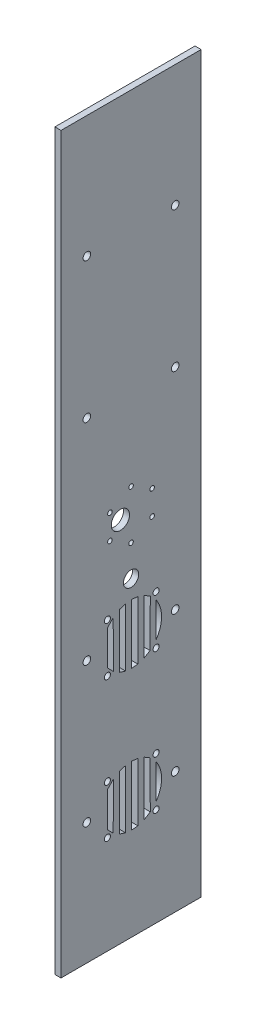
from build123d import *

# Parameters (mm, degrees)
CROQUIS3_W              = 92
CROQUIS3_H              = 482
CROQUIS3_R              = 2.5
CROQUIS3_R_2            = 2
CROQUIS3_R_3            = 5
CROQUIS3_R_4            = 1.5
CROQUIS3_R_5            = 6
SALIENTE_EXTRUIR1_DEPTH = 4
CORTAR_EXTRUIR1_DEPTH   = 10


with BuildPart() as part:
    # Croquis3 → Saliente-Extruir1 (new body)
    with BuildSketch(Plane.ZY.offset(90.501614904)):
        with Locations((-42, 944.628389678)):
            Rectangle(CROQUIS3_W, CROQUIS3_H)
        with Locations((-71.000454801, 783.628389678)):
            Circle(CROQUIS3_R, mode=Mode.SUBTRACT)
        with Locations((-58.458881304, 768.118311041)):
            Circle(CROQUIS3_R_2, mode=Mode.SUBTRACT)
        with Locations((-58.458881304, 800.118311041)):
            Circle(CROQUIS3_R_2, mode=Mode.SUBTRACT)
        with Locations((-26.458881304, 800.118311041)):
            Circle(CROQUIS3_R_2, mode=Mode.SUBTRACT)
        with Locations((-26.458881304, 768.118311041)):
            Circle(CROQUIS3_R_2, mode=Mode.SUBTRACT)
        with Locations((-13.000454801, 783.628389678)):
            Circle(CROQUIS3_R, mode=Mode.SUBTRACT)
        with Locations((-58.458881304, 860.118311041)):
            Circle(CROQUIS3_R_2, mode=Mode.SUBTRACT)
        with Locations((-58.458881304, 892.118311041)):
            Circle(CROQUIS3_R_2, mode=Mode.SUBTRACT)
        with Locations((-26.458881304, 892.118311041)):
            Circle(CROQUIS3_R_2, mode=Mode.SUBTRACT)
        with Locations((-26.458881304, 860.118311041)):
            Circle(CROQUIS3_R_2, mode=Mode.SUBTRACT)
        with Locations((-13.000454801, 875.628389678)):
            Circle(CROQUIS3_R, mode=Mode.SUBTRACT)
        with Locations((-42.000454801, 907.728389678)):
            Circle(CROQUIS3_R_3, mode=Mode.SUBTRACT)
        with Locations((-42.000454801, 928.11276849)):
            Circle(CROQUIS3_R_4, mode=Mode.SUBTRACT)
        with Locations((-35.000454801, 944.628389678)):
            Circle(CROQUIS3_R_5, mode=Mode.SUBTRACT)
        with Locations((-28.137284168, 936.116673787)):
            Circle(CROQUIS3_R_4, mode=Mode.SUBTRACT)
        with Locations((-28.137284168, 952.124484381)):
            Circle(CROQUIS3_R_4, mode=Mode.SUBTRACT)
        with Locations((-42.000454801, 960.128389678)):
            Circle(CROQUIS3_R_4, mode=Mode.SUBTRACT)
        with Locations((-55.863625434, 952.124484381)):
            Circle(CROQUIS3_R_4, mode=Mode.SUBTRACT)
        with Locations((-55.863625434, 936.116673787)):
            Circle(CROQUIS3_R_4, mode=Mode.SUBTRACT)
        with Locations((-71.000454801, 1013.628389678)):
            Circle(CROQUIS3_R, mode=Mode.SUBTRACT)
        with Locations((-13.000454801, 1013.628389678)):
            Circle(CROQUIS3_R, mode=Mode.SUBTRACT)
        with Locations((-13.000454801, 1105.628389678)):
            Circle(CROQUIS3_R, mode=Mode.SUBTRACT)
        with Locations((-71.000454801, 1105.628389678)):
            Circle(CROQUIS3_R, mode=Mode.SUBTRACT)
        with Locations((-71.000454801, 875.628389678)):
            Circle(CROQUIS3_R, mode=Mode.SUBTRACT)
        with BuildLine():
            Line((-58.458881304, 795.421766265), (-58.458881304, 772.814855817))
            ThreePointArc((-58.458881304, 772.814855817), (-62.048881304, 784.118311041), (-58.458881304, 795.421766265))
        make_face(mode=Mode.SUBTRACT)
        Polygon((-50.458881304, 802.000371885), (-50.458881304, 766.236250198), (-54.642369893, 768.777818683), (-54.458881304, 799.602758077), align=None, mode=Mode.SUBTRACT)
        Polygon((-46.458881304, 803.29559187), (-46.458881304, 764.941030212), (-42.458881304, 764.528311041), (-42.458881304, 803.708311041), align=None, mode=Mode.SUBTRACT)
        Polygon((-38.458881304, 803.29559187), (-38.458881304, 764.941030212), (-34.458881304, 766.236250198), (-34.458881304, 802.000371885), align=None, mode=Mode.SUBTRACT)
        Polygon((-30.458881304, 799.602758077), (-30.275392715, 768.777818683), (-26.458881304, 772.814855817), (-26.458881304, 795.421766265), align=None, mode=Mode.SUBTRACT)
        Polygon((-26.458881304, 887.421766265), (-30.275392715, 891.4588034), (-30.458881304, 860.633864006), (-26.458881304, 864.814855817), align=None, mode=Mode.SUBTRACT)
        Polygon((-34.458881304, 894.000371885), (-38.458881304, 895.29559187), (-38.458881304, 856.941030212), (-34.458881304, 858.236250198), align=None, mode=Mode.SUBTRACT)
        Polygon((-42.458881304, 895.708311041), (-46.458881304, 895.29559187), (-46.458881304, 856.941030212), (-42.458881304, 856.528311041), align=None, mode=Mode.SUBTRACT)
        Polygon((-50.458881304, 894.000371885), (-54.642369893, 891.4588034), (-54.458881304, 860.633864006), (-50.458881304, 858.236250198), align=None, mode=Mode.SUBTRACT)
    extrude(amount=SALIENTE_EXTRUIR1_DEPTH)

    # Croquis4 → Cortar-Extruir1 (cut)
    with BuildSketch(Plane(origin=(-90.501614904, 0, 0), x_dir=(0, 0, -1), z_dir=(1, 0, 0))):
        with BuildLine():
            Line((58.458881304, 887.421766265), (58.458881304, 864.814855817))
            ThreePointArc((58.458881304, 864.814855817), (62.048881304, 876.118311041), (58.458881304, 887.421766265))
        make_face()
    extrude(amount=-CORTAR_EXTRUIR1_DEPTH, mode=Mode.SUBTRACT)


solid = part.part
